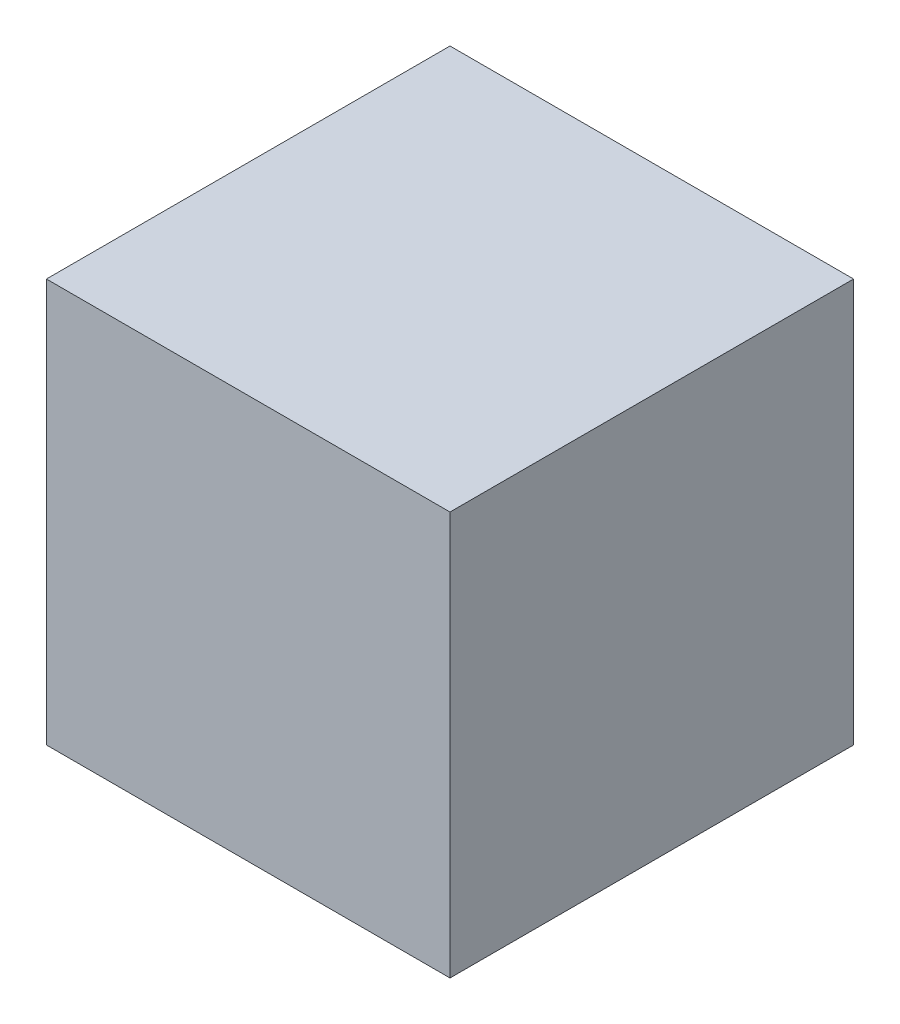
from build123d import *

# Parameters (mm, degrees)
SKIZZE1_W                       = 70
SKIZZE1_H                       = 70
AUFSATZ_LINEAR_AUSTRAGEN1_DEPTH = 70


with BuildPart() as part:
    # Skizze1 → Aufsatz-Linear austragen1 (new body)
    with BuildSketch(Plane.XY):
        with Locations((35, 35)):
            Rectangle(SKIZZE1_W, SKIZZE1_H)
    extrude(amount=AUFSATZ_LINEAR_AUSTRAGEN1_DEPTH)


solid = part.part
